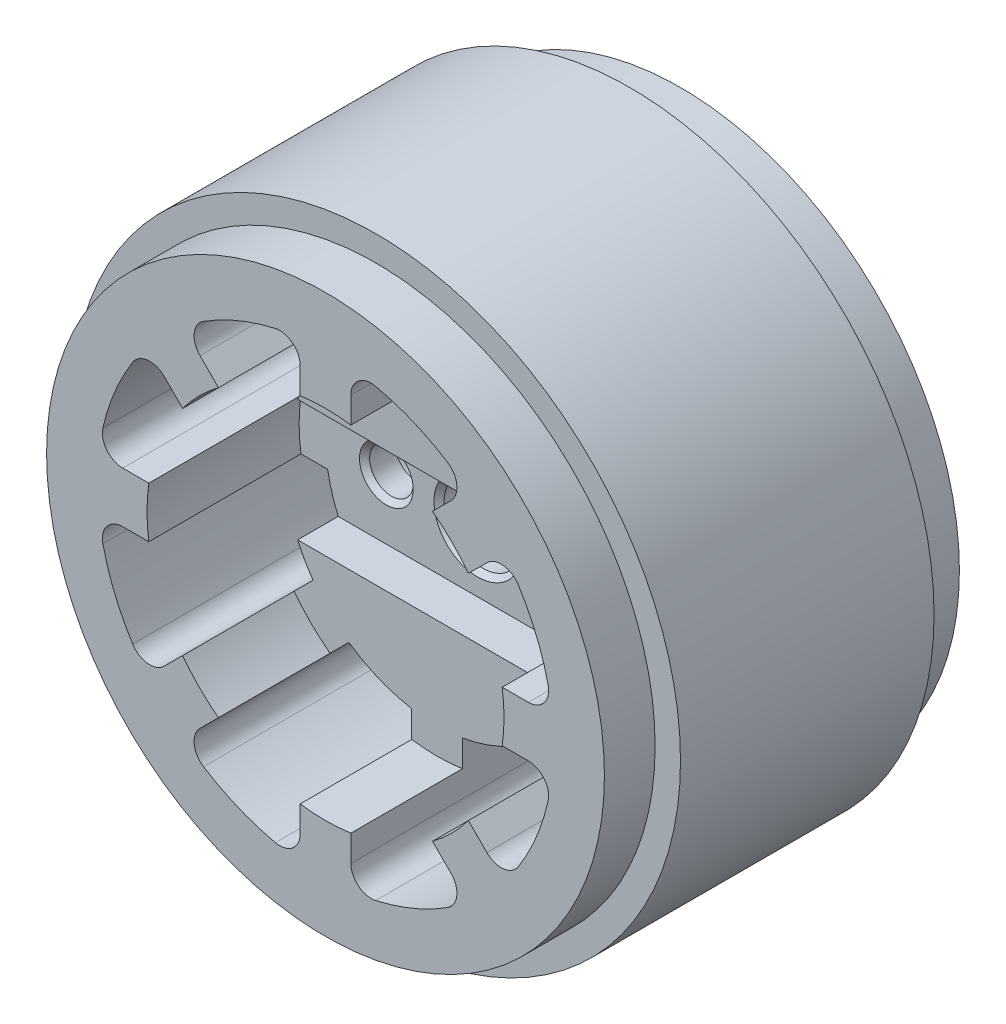
from build123d import *

# Parameters (mm, degrees)
BOSS_EXTRUDE7_START       = 3
SKETCH1_15_R              = 15
BOSS_EXTRUDE7_DEPTH       = 12
CUT_EXTRUDE2_START        = 3
SKETCH1_16_R              = 3.8
CUT_EXTRUDE2_DEPTH        = 15
SKETCH1_18_R              = 3
CUT_EXTRUDE4_DEPTH        = 12
CUT_EXTRUDE5_START        = 15
SKETCH1_19_R              = 2.15
CUT_EXTRUDE5_DEPTH        = 3
SKETCH1_R                 = 2.15
CUT_EXTRUDE6_DEPTH        = 15
BOSS_EXTRUDE12_START      = 15
BOSS_EXTRUDE12_DEPTH      = 4
BOSS_EXTRUDE13_DEPTH      = 30
BOSS_EXTRUDE13_DEPTH_BACK = 5
SKETCH1_23_R              = 27.5
SKETCH1_23_R_2            = 22.5
BOSS_EXTRUDE14_DEPTH      = 30
BOSS_EXTRUDE16_DEPTH      = 15
SKETCH1_28_R              = 30
SKETCH1_28_R_2            = 27.5
BOSS_EXTRUDE18_DEPTH      = 25
BOSS_EXTRUDE19_DEPTH      = 23
BOSS_EXTRUDE19_DEPTH_BACK = 5
BOSS_EXTRUDE19_START      = 5
CHAMFER5_SIZE             = 0.5
FILLET1_R                 = 2
BOSS_EXTRUDE20_DEPTH      = 19


# Read off the part's stored shape, not the designer's step: Boss-Extrude16
with BuildPart() as part:
    # Sketch1<15> → Boss-Extrude7 (new body)
    with BuildSketch(Plane.XY.offset(BOSS_EXTRUDE7_START)):
        Circle(SKETCH1_15_R)
    extrude(amount=BOSS_EXTRUDE7_DEPTH)

    # Sketch1<16> → Cut-Extrude2 (cut)
    with BuildSketch(Plane.XY.offset(CUT_EXTRUDE2_START)):
        Circle(SKETCH1_16_R)
    extrude(amount=CUT_EXTRUDE2_DEPTH, mode=Mode.SUBTRACT)

    # Sketch1<18> → Cut-Extrude4 (cut)
    with BuildSketch(Plane.XY):
        with Locations((9, 0)):
            Circle(SKETCH1_18_R)
        with Locations((-9, 0)):
            Circle(SKETCH1_18_R)
    extrude(amount=CUT_EXTRUDE4_DEPTH, mode=Mode.SUBTRACT)

    # Sketch1<19> → Cut-Extrude5 (cut)
    with BuildSketch(Plane.XY.offset(CUT_EXTRUDE5_START)):
        with Locations((-9, 0)):
            Circle(SKETCH1_19_R)
    extrude(amount=-CUT_EXTRUDE5_DEPTH, mode=Mode.SUBTRACT)

    # Sketch1 → Cut-Extrude6 (cut)
    with BuildSketch(Plane.XY):
        with Locations((9, 0)):
            Circle(SKETCH1_R)
    extrude(amount=CUT_EXTRUDE6_DEPTH, mode=Mode.SUBTRACT)

    # Sketch1<22> → Boss-Extrude12 (add)
    with BuildSketch(Plane.XY.offset(BOSS_EXTRUDE12_START)):
        with BuildLine():
            ThreePointArc((8.690483379, 12.226017285), (5.740251485, 13.858192988), (2.5, 14.790199458))
            ThreePointArc((2.5, 14.790199458), (0, 15), (-2.5, 14.790199458))
            ThreePointArc((-2.5, 14.790199458), (-5.740251485, 13.858192988), (-8.690483379, 12.226017285))
            ThreePointArc((-8.690483379, 12.226017285), (-10.606601718, 10.606601718), (-12.226017285, 8.690483379))
            ThreePointArc((-12.226017285, 8.690483379), (-13.056359536, 7.384543023), (-13.747727085, 6))
            Line((-13.747727085, 6), (13.747727085, 6))
            ThreePointArc((13.747727085, 6), (13.056359536, 7.384543023), (12.226017285, 8.690483379))
            ThreePointArc((12.226017285, 8.690483379), (10.606601718, 10.606601718), (8.690483379, 12.226017285))
        make_face()
        with BuildLine():
            ThreePointArc((12.226017285, -8.690483379), (13.056359536, -7.384543023), (13.747727085, -6))
            Line((13.747727085, -6), (-13.747727085, -6))
            ThreePointArc((-13.747727085, -6), (-13.056359536, -7.384543023), (-12.226017285, -8.690483379))
            ThreePointArc((-12.226017285, -8.690483379), (-10.606601718, -10.606601718), (-8.690483379, -12.226017285))
            ThreePointArc((-8.690483379, -12.226017285), (-5.740251485, -13.858192988), (-2.5, -14.790199458))
            ThreePointArc((-2.5, -14.790199458), (0, -15), (2.5, -14.790199458))
            ThreePointArc((2.5, -14.790199458), (5.740251485, -13.858192988), (8.690483379, -12.226017285))
            ThreePointArc((8.690483379, -12.226017285), (10.606601718, -10.606601718), (12.226017285, -8.690483379))
        make_face()
    extrude(amount=BOSS_EXTRUDE12_DEPTH)

    # Boss-Extrude16 outline → Boss-Extrude16 (add)
    with BuildSketch(Plane.XY):
        with BuildLine():
            ThreePointArc((-14.790199458, -2.5), (-15, 0), (-14.790199458, 2.5))
            Line((-14.790199458, 2.5), (-17.421538394, 2.5))
            ThreePointArc((-17.421538394, 2.5), (-17.6, 0), (-17.421538394, -2.5))
            Line((-17.421538394, -2.5), (-14.790199458, -2.5))
        make_face()
        with BuildLine():
            Line((17.421538394, 2.5), (14.790199458, 2.5))
            ThreePointArc((14.790199458, 2.5), (15, 0), (14.790199458, -2.5))
            Line((14.790199458, -2.5), (17.421538394, -2.5))
            ThreePointArc((17.421538394, -2.5), (17.6, 0), (17.421538394, 2.5))
        make_face()
    extrude(amount=BOSS_EXTRUDE16_DEPTH)


with BuildPart() as body_2:
    # Sketch1<23> → Boss-Extrude13 (new, two sides: drawn at the far end of the back side and taken through both)
    with BuildSketch(Plane.XY.offset(-BOSS_EXTRUDE13_DEPTH_BACK)):
        Circle(SKETCH1_23_R)
        Circle(SKETCH1_23_R_2, mode=Mode.SUBTRACT)
    extrude(amount=BOSS_EXTRUDE13_DEPTH + BOSS_EXTRUDE13_DEPTH_BACK)

    # Sketch1<24> → Boss-Extrude14 (add)
    with BuildSketch(Plane.XY):
        with BuildLine():
            Line((2.5, 17.421538394), (2.5, 22.360679775))
            ThreePointArc((2.5, 22.360679775), (0, 22.5), (-2.5, 22.360679775))
            Line((-2.5, 22.360679775), (-2.5, 17.421538394))
            ThreePointArc((-2.5, 17.421538394), (0, 17.6), (2.5, 17.421538394))
        make_face()
        with BuildLine():
            ThreePointArc((17.579155254, 14.043621348), (15.909902577, 15.909902577), (14.043621348, 17.579155254))
            Line((14.043621348, 17.579155254), (10.551120984, 14.08665489))
            ThreePointArc((10.551120984, 14.08665489), (12.445079349, 12.445079349), (14.08665489, 10.551120984))
            Line((14.08665489, 10.551120984), (17.579155254, 14.043621348))
        make_face()
        with BuildLine():
            Line((-10.551120984, 14.08665489), (-14.043621348, 17.579155254))
            ThreePointArc((-14.043621348, 17.579155254), (-15.909902577, 15.909902577), (-17.579155254, 14.043621348))
            Line((-17.579155254, 14.043621348), (-14.08665489, 10.551120984))
            ThreePointArc((-14.08665489, 10.551120984), (-12.445079349, 12.445079349), (-10.551120984, 14.08665489))
        make_face()
        with BuildLine():
            ThreePointArc((22.360679775, -2.5), (22.5, 0), (22.360679775, 2.5))
            Line((22.360679775, 2.5), (17.421538394, 2.5))
            ThreePointArc((17.421538394, 2.5), (17.6, 0), (17.421538394, -2.5))
            Line((17.421538394, -2.5), (22.360679775, -2.5))
        make_face()
        with BuildLine():
            Line((-17.421538394, 2.5), (-22.360679775, 2.5))
            ThreePointArc((-22.360679775, 2.5), (-22.5, 0), (-22.360679775, -2.5))
            Line((-22.360679775, -2.5), (-17.421538394, -2.5))
            ThreePointArc((-17.421538394, -2.5), (-17.6, 0), (-17.421538394, 2.5))
        make_face()
        with BuildLine():
            ThreePointArc((14.043621348, -17.579155254), (15.909902577, -15.909902577), (17.579155254, -14.043621348))
            Line((17.579155254, -14.043621348), (14.08665489, -10.551120984))
            ThreePointArc((14.08665489, -10.551120984), (12.445079349, -12.445079349), (10.551120984, -14.08665489))
            Line((10.551120984, -14.08665489), (14.043621348, -17.579155254))
        make_face()
        with BuildLine():
            Line((-14.08665489, -10.551120984), (-17.579155254, -14.043621348))
            ThreePointArc((-17.579155254, -14.043621348), (-15.909902577, -15.909902577), (-14.043621348, -17.579155254))
            Line((-14.043621348, -17.579155254), (-10.551120984, -14.08665489))
            ThreePointArc((-10.551120984, -14.08665489), (-12.445079349, -12.445079349), (-14.08665489, -10.551120984))
        make_face()
        with BuildLine():
            ThreePointArc((-2.5, -22.360679775), (0, -22.5), (2.5, -22.360679775))
            Line((2.5, -22.360679775), (2.5, -17.421538394))
            ThreePointArc((2.5, -17.421538394), (0, -17.6), (-2.5, -17.421538394))
            Line((-2.5, -17.421538394), (-2.5, -22.360679775))
        make_face()
    extrude(amount=BOSS_EXTRUDE14_DEPTH)


    add(part.part)  # Boss-Extrude19 merges part


with BuildPart() as body_3:
    # Sketch1<28> → Boss-Extrude18 (new body)
    with BuildSketch(Plane.XY):
        Circle(SKETCH1_28_R)
        Circle(SKETCH1_28_R_2, mode=Mode.SUBTRACT)
    extrude(amount=BOSS_EXTRUDE18_DEPTH)


with BuildPart() as body_2_1:
    add(body_2.part)

    add(body_3.part)  # Boss-Extrude19 merges body 3
    # Sketch1<32> → Boss-Extrude19 (add, two sides: drawn at the far end of the back side and taken through both)
    with BuildSketch(Plane.XY.offset(BOSS_EXTRUDE19_START - BOSS_EXTRUDE19_DEPTH_BACK)):
        with BuildLine():
            ThreePointArc((14.043621348, -17.579155254), (15.909902577, -15.909902577), (17.579155254, -14.043621348))
            Line((17.579155254, -14.043621348), (14.08665489, -10.551120984))
            ThreePointArc((14.08665489, -10.551120984), (12.445079349, -12.445079349), (10.551120984, -14.08665489))
            Line((10.551120984, -14.08665489), (14.043621348, -17.579155254))
        make_face()
        with BuildLine():
            ThreePointArc((22.5, 0), (22.465142943, 1.251939508), (22.360679775, 2.5))
            Line((22.360679775, 2.5), (17.421538394, 2.5))
            ThreePointArc((17.421538394, 2.5), (17.555327905, 1.253180807), (17.6, 0))
            ThreePointArc((17.6, 0), (17.555327905, -1.253180807), (17.421538394, -2.5))
            Line((17.421538394, -2.5), (22.360679775, -2.5))
            ThreePointArc((22.360679775, -2.5), (22.465142943, -1.251939508), (22.5, 0))
        make_face()
        with BuildLine():
            ThreePointArc((17.579155254, 14.043621348), (15.909902577, 15.909902577), (14.043621348, 17.579155254))
            Line((14.043621348, 17.579155254), (10.551120984, 14.08665489))
            ThreePointArc((10.551120984, 14.08665489), (12.445079349, 12.445079349), (14.08665489, 10.551120984))
            Line((14.08665489, 10.551120984), (17.579155254, 14.043621348))
        make_face()
        with BuildLine():
            Line((2.5, 17.421538394), (2.5, 22.360679775))
            ThreePointArc((2.5, 22.360679775), (0, 22.5), (-2.5, 22.360679775))
            Line((-2.5, 22.360679775), (-2.5, 17.421538394))
            ThreePointArc((-2.5, 17.421538394), (0, 17.6), (2.5, 17.421538394))
        make_face()
        with BuildLine():
            Line((-10.551120984, 14.08665489), (-14.043621348, 17.579155254))
            ThreePointArc((-14.043621348, 17.579155254), (-15.909902577, 15.909902577), (-17.579155254, 14.043621348))
            Line((-17.579155254, 14.043621348), (-14.08665489, 10.551120984))
            ThreePointArc((-14.08665489, 10.551120984), (-12.445079349, 12.445079349), (-10.551120984, 14.08665489))
        make_face()
        with BuildLine():
            Line((-17.421538394, 2.5), (-22.360679775, 2.5))
            ThreePointArc((-22.360679775, 2.5), (-22.5, 0), (-22.360679775, -2.5))
            Line((-22.360679775, -2.5), (-17.421538394, -2.5))
            ThreePointArc((-17.421538394, -2.5), (-17.6, 0), (-17.421538394, 2.5))
        make_face()
        with BuildLine():
            Line((-14.08665489, -10.551120984), (-17.579155254, -14.043621348))
            ThreePointArc((-17.579155254, -14.043621348), (-15.909902577, -15.909902577), (-14.043621348, -17.579155254))
            Line((-14.043621348, -17.579155254), (-10.551120984, -14.08665489))
            ThreePointArc((-10.551120984, -14.08665489), (-12.445079349, -12.445079349), (-14.08665489, -10.551120984))
        make_face()
        with BuildLine():
            ThreePointArc((-2.5, -22.360679775), (0, -22.5), (2.5, -22.360679775))
            Line((2.5, -22.360679775), (2.5, -17.421538394))
            ThreePointArc((2.5, -17.421538394), (0, -17.6), (-2.5, -17.421538394))
            Line((-2.5, -17.421538394), (-2.5, -22.360679775))
        make_face()
    extrude(amount=BOSS_EXTRUDE19_DEPTH + BOSS_EXTRUDE19_DEPTH_BACK)

    # Chamfer5
    chamfer5_edges = [body_2_1.edges().sort_by_distance(p)[0] for p in [
        (-3.8, 0, 3),
        (-12, 0, 3),
        (-3.8, 0, 15),
        (6, 0, 3),
        (-11.15, 0, 15),
        (6.85, 0, 15),
    ]]
    chamfer(chamfer5_edges, length=CHAMFER5_SIZE)

    # Fillet1
    fillet1_edges = [body_2_1.edges().sort_by_distance(p)[0] for p in [
        (-17.579155254, -14.043621348, 15),
        (-14.043621348, -17.579155254, 15),
        (-22.360679775, 2.5, 15),
        (-22.360679775, -2.5, 15),
        (-14.043621348, 17.579155254, 15),
        (-17.579155254, 14.043621348, 15),
        (2.5, 22.360679775, 15),
        (-2.5, 22.360679775, 15),
        (17.579155254, 14.043621348, 15),
        (14.043621348, 17.579155254, 15),
        (22.360679775, -2.5, 15),
        (22.360679775, 2.5, 15),
        (14.043621348, -17.579155254, 15),
        (17.579155254, -14.043621348, 15),
        (-2.5, -22.360679775, 15),
        (2.5, -22.360679775, 15),
    ]]
    fillet(fillet1_edges, radius=FILLET1_R)

    # Sketch1<33> → Boss-Extrude20 (add)
    with BuildSketch(Plane.XY):
        with BuildLine():
            Line((2.5, 14.790199458), (2.5, 17.421538394))
            ThreePointArc((2.5, 17.421538394), (0, 17.6), (-2.5, 17.421538394))
            Line((-2.5, 17.421538394), (-2.5, 14.790199458))
            ThreePointArc((-2.5, 14.790199458), (0, 15), (2.5, 14.790199458))
        make_face()
        with BuildLine():
            Line((-8.690483379, 12.226017285), (-10.551120984, 14.08665489))
            ThreePointArc((-10.551120984, 14.08665489), (-12.445079349, 12.445079349), (-14.08665489, 10.551120984))
            Line((-14.08665489, 10.551120984), (-12.226017285, 8.690483379))
            ThreePointArc((-12.226017285, 8.690483379), (-10.606601718, 10.606601718), (-8.690483379, 12.226017285))
        make_face()
        with BuildLine():
            Line((-12.226017285, -8.690483379), (-14.08665489, -10.551120984))
            ThreePointArc((-14.08665489, -10.551120984), (-12.445079349, -12.445079349), (-10.551120984, -14.08665489))
            Line((-10.551120984, -14.08665489), (-8.690483379, -12.226017285))
            ThreePointArc((-8.690483379, -12.226017285), (-10.606601718, -10.606601718), (-12.226017285, -8.690483379))
        make_face()
        with BuildLine():
            ThreePointArc((-2.5, -17.421538394), (0, -17.6), (2.5, -17.421538394))
            Line((2.5, -17.421538394), (2.5, -14.790199458))
            ThreePointArc((2.5, -14.790199458), (0, -15), (-2.5, -14.790199458))
            Line((-2.5, -14.790199458), (-2.5, -17.421538394))
        make_face()
        with BuildLine():
            ThreePointArc((10.551120984, -14.08665489), (12.445079349, -12.445079349), (14.08665489, -10.551120984))
            Line((14.08665489, -10.551120984), (12.226017285, -8.690483379))
            ThreePointArc((12.226017285, -8.690483379), (10.606601718, -10.606601718), (8.690483379, -12.226017285))
            Line((8.690483379, -12.226017285), (10.551120984, -14.08665489))
        make_face()
        with BuildLine():
            ThreePointArc((14.08665489, 10.551120984), (12.445079349, 12.445079349), (10.551120984, 14.08665489))
            Line((10.551120984, 14.08665489), (8.690483379, 12.226017285))
            ThreePointArc((8.690483379, 12.226017285), (10.606601718, 10.606601718), (12.226017285, 8.690483379))
            Line((12.226017285, 8.690483379), (14.08665489, 10.551120984))
        make_face()
    extrude(amount=BOSS_EXTRUDE20_DEPTH)


solid = body_2_1.part
